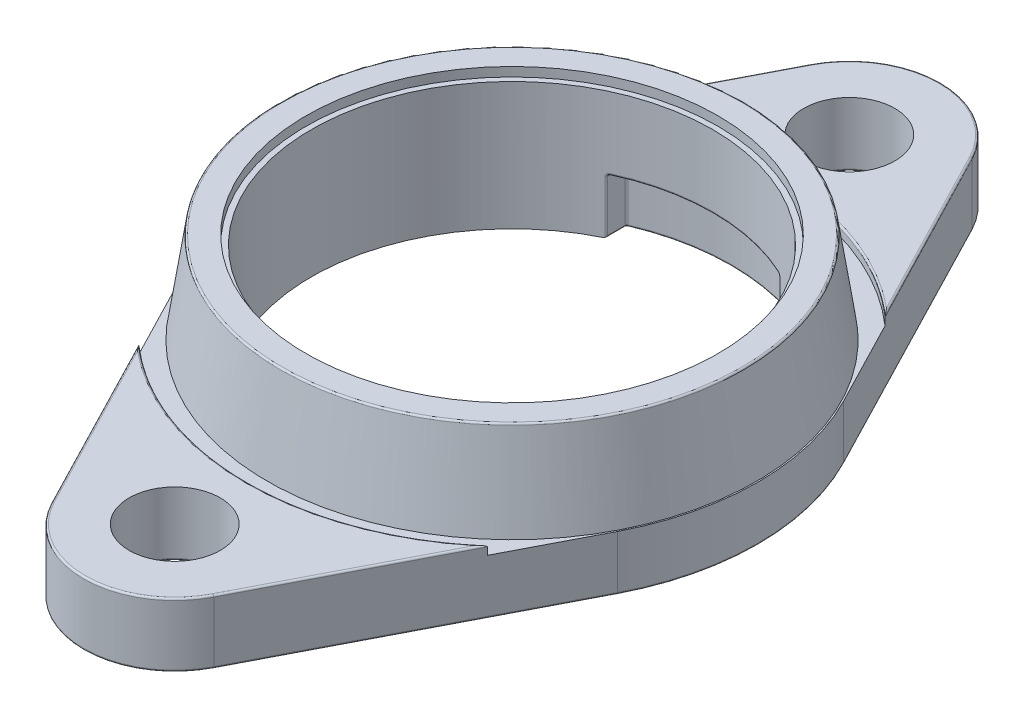
from build123d import *
from build123d.topology import SkipClean

# Parameters (mm, degrees)
ESBO_O3_R                      = 11
ESBO_O3_R_2                    = 2.5
RESSALTO_EXTRUS_O1_DEPTH       = 3
RESSALTO_EXTRUS_O2_DEPTH       = 0.5
CORTE_EXTRUS_O1_DEPTH          = 0.5
CORTE_EXTRUS_O2_DEPTH          = 3
FILETE1_R                      = 0.1
FURO_DE_DI_METRO_5_0_5_1_D     = 5
FURO_DE_DI_METRO_5_0_5_1_DEPTH = 11.35
FURO_DE_DI_METRO_5_0_5_1_TIP   = 1.502151548


with BuildPart() as part:
    # Esboço3 → Ressalto-extrusão1 (new body)
    with BuildSketch(Plane(origin=(0, 0, 0), x_dir=(1, 0, 0), z_dir=(0, 1, 0))):
        with BuildLine():
            Line((-11.990683016, 6.202702703), (-4.44099371, 20.797297297))
            ThreePointArc((-4.44099371, 20.797297297), (0, 23.5), (4.44099371, 20.797297297))
            Line((4.44099371, 20.797297297), (11.990683016, 6.202702703))
            ThreePointArc((11.990683016, 6.202702703), (13.5, 0), (11.990683016, -6.202702703))
            Line((11.990683016, -6.202702703), (4.44099371, -20.797297297))
            ThreePointArc((4.44099371, -20.797297297), (0, -23.5), (-4.44099371, -20.797297297))
            Line((-4.44099371, -20.797297297), (-11.990683016, -6.202702703))
            ThreePointArc((-11.990683016, -6.202702703), (-13.5, 0), (-11.990683016, 6.202702703))
        make_face()
        Circle(ESBO_O3_R, mode=Mode.SUBTRACT)
        with Locations((0, 18.5)):
            Circle(ESBO_O3_R_2, mode=Mode.SUBTRACT)
        with Locations((0, -18.5)):
            Circle(ESBO_O3_R_2, mode=Mode.SUBTRACT)
    extrude(amount=RESSALTO_EXTRUS_O1_DEPTH)

    # Esboço4 → Revolução1 (revolve)
    with SkipClean():  # the faces are left unmerged after this step: merging them gives an invalid solid
        with BuildSketch(Plane(origin=(0, 0, 0), x_dir=(0, 0, -1), z_dir=(1, 0, 0))):
            Polygon((-11, 3), (-11, 7.5), (-11.3, 7.5), (-11.3, 8), (-12.675, 8), (-13.425, 3), align=None)
        revolve(axis=Axis((0, 0, 0), (0, 1, 0)))
    add(part.part.scale(1), mode=Mode.REPLACE)  # the faces are merged on a copy

    # Esboço6 → Ressalto-extrusão2 (add)
    with BuildSketch(Plane(origin=(0, 3, 0), x_dir=(1, 0, 0), z_dir=(0, 1, 0))):
        with BuildLine():
            Line((-9.559452081, 10.902608674), (-4.44099371, 20.797297297))
            ThreePointArc((-4.44099371, 20.797297297), (0, 23.5), (4.44099371, 20.797297297))
            Line((4.44099371, 20.797297297), (9.559452081, 10.902608674))
            ThreePointArc((9.559452081, 10.902608674), (0, 14.5), (-9.559452081, 10.902608674))
        make_face()
        with BuildLine():
            Line((-9.559452081, -10.902608674), (-4.44099371, -20.797297297))
            ThreePointArc((-4.44099371, -20.797297297), (0, -23.5), (4.44099371, -20.797297297))
            Line((4.44099371, -20.797297297), (9.559452081, -10.902608674))
            ThreePointArc((9.559452081, -10.902608674), (0, -14.5), (-9.559452081, -10.902608674))
        make_face()
    extrude(amount=RESSALTO_EXTRUS_O2_DEPTH)

    # Esboço7 → Corte-extrusão1 (cut)
    with BuildSketch(Plane.XZ):
        with BuildLine():
            Line((-4.316701946, -17.228746953), (-10.436335217, -5.398648649))
            ThreePointArc((-10.436335217, -5.398648649), (-11.75, 0), (-10.436335217, 5.398648649))
            Line((-10.436335217, 5.398648649), (-4.316701946, 17.228746953))
            ThreePointArc((-4.316701946, 17.228746953), (0, 14), (4.316701946, 17.228746953))
            Line((4.316701946, 17.228746953), (10.436335217, 5.398648649))
            ThreePointArc((10.436335217, 5.398648649), (11.75, 0), (10.436335217, -5.398648649))
            Line((10.436335217, -5.398648649), (4.316701946, -17.228746953))
            ThreePointArc((4.316701946, -17.228746953), (0, -14), (-4.316701946, -17.228746953))
        make_face()
    extrude(amount=-CORTE_EXTRUS_O1_DEPTH, mode=Mode.SUBTRACT)

    # Esboço8 → Corte-extrusão2 (cut)
    with BuildSketch(Plane.XZ.offset(-0.5)):
        with BuildLine():
            Line((-4.75, 11.01986842), (-4.75, 9.921567416))
            ThreePointArc((-4.75, 9.921567416), (0, 11), (4.75, 9.921567416))
            Line((4.75, 9.921567416), (4.75, 11.01986842))
            ThreePointArc((4.75, 11.01986842), (0, 12), (-4.75, 11.01986842))
        make_face()
        with BuildLine():
            Line((-4.75, -9.921567416), (-4.75, -11.01986842))
            ThreePointArc((-4.75, -11.01986842), (0, -12), (4.75, -11.01986842))
            Line((4.75, -11.01986842), (4.75, -9.921567416))
            ThreePointArc((4.75, -9.921567416), (0, -11), (-4.75, -9.921567416))
        make_face()
    extrude(amount=-CORTE_EXTRUS_O2_DEPTH, mode=Mode.SUBTRACT)

    # Filete1
    filete1_edges = [part.edges().sort_by_distance(p)[0] for p in [
        (4.75, 0.5, -10.470717918),
        (4.75, 1.75, -9.921567416),
        (4.75, 0.5, 10.470717918),
        (-4.75, 2, -11.01986842),
        (4.75, 2, -11.01986842),
        (0, 0.5, -12),
        (-4.75, 3.5, -10.470717918),
        (0, 3.5, -11),
        (4.75, 3.5, -10.470717918),
        (0, 3.5, -12),
        (-2.5, 0, 18.5),
        (-8.215838363, 0, 13.5),
        (0, 0, 23.5),
        (8.215838363, 0, 13.5),
        (13.5, 0, 0),
        (8.215838363, 0, -13.5),
        (0, 0, -23.5),
        (-8.215838363, 0, -13.5),
        (-13.5, 0, 0),
        (-2.5, 0, -18.5),
        (0, 0, 14),
        (-7.376518582, 0, 11.313697801),
        (-11.75, 0, 0),
        (-7.376518582, 0, -11.313697801),
        (0, 0, -14),
        (7.376518582, 0, -11.313697801),
        (11.75, 0, 0),
        (7.376518582, 0, 11.313697801),
        (7.000222895, 3.5, 15.849952986),
        (0, 3.5, 23.5),
        (-7.000222895, 3.5, 15.849952986),
        (0, 3.5, 14.5),
        (-7.000222895, 3.5, -15.849952986),
        (0, 3.5, -23.5),
        (7.000222895, 3.5, -15.849952986),
        (0, 3.5, -14.5),
        (-4.75, 0.5, -10.470717918),
        (-4.75, 1.75, -9.921567416),
        (4.75, 2, 11.01986842),
        (4.75, 3.5, 10.470717918),
        (0, 0.5, 12),
        (-4.75, 0.5, 10.470717918),
        (-4.75, 3.5, 10.470717918),
        (0, 3.5, 12),
        (4.75, 1.75, 9.921567416),
        (-2.435442303, 3.5, 10.727004278),
        (-4.75, 1.75, 9.921567416),
        (0, 8, -12.675),
    ]]
    fillet(filete1_edges, radius=FILETE1_R)

    # Furo de diâmetro Ø5.0 (5)1
    with Locations(Plane(origin=(0, 3.5, -18.5), x_dir=(0, 0, 1), z_dir=(0, 1, 0))):
        with Locations((0, 0), (37, 0)):
            Hole(FURO_DE_DI_METRO_5_0_5_1_D / 2, depth=FURO_DE_DI_METRO_5_0_5_1_DEPTH)
            with Locations((0, 0, -(FURO_DE_DI_METRO_5_0_5_1_DEPTH + FURO_DE_DI_METRO_5_0_5_1_TIP / 2))):  # 118° drill point
                Cone(0, FURO_DE_DI_METRO_5_0_5_1_D / 2, FURO_DE_DI_METRO_5_0_5_1_TIP, mode=Mode.SUBTRACT)


solid = part.part
